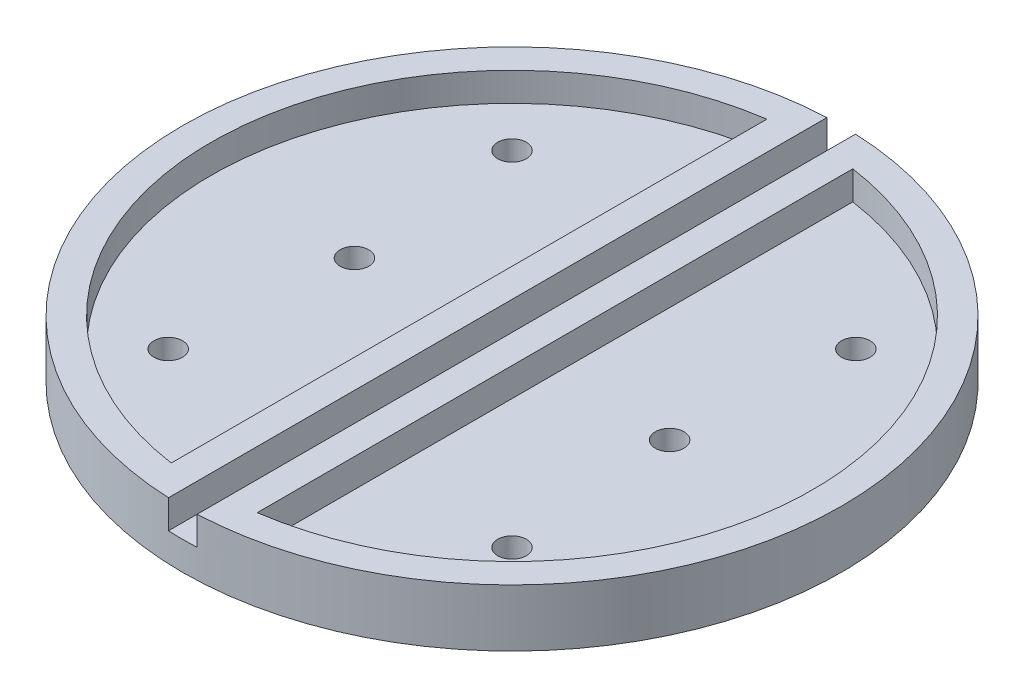
from build123d import *

# Parameters (mm, degrees)
SKETCH5_R           = 73.025
SKETCH5_R_2         = 3.175
PLATEBASE_DEPTH     = 6.35
PLATETOP_DEPTH      = 6.35
SKETCH9_R           = 73.025
SKETCH9_R_2         = 66.675
PLATEWALLS_DEPTH    = 6.35
TOPSLOTCUT_START    = -6.35
TOPSLOTCUT_DEPTH    = 6.35
BOTTOMSLOTCUT_START = -6.35
BOTTOMSLOTCUT_DEPTH = 6.35
SKETCH13_R          = 3.175
RIGHTTHRUHOLE_DEPTH = 6.35
SKETCH14_R          = 3.175
LEFTTHRUHOLE_DEPTH  = 6.35


with BuildPart() as part:
    # Sketch5 → PlateBase (new body)
    with BuildSketch(Plane(origin=(0, 0, 0), x_dir=(1, 0, 0), z_dir=(0, 1, 0))):
        Circle(SKETCH5_R)
        with Locations((38.1, 38.1)):
            Circle(SKETCH5_R_2, mode=Mode.SUBTRACT)
        with Locations((38.1, -38.1)):
            Circle(SKETCH5_R_2, mode=Mode.SUBTRACT)
        with Locations((-38.1, 38.1)):
            Circle(SKETCH5_R_2, mode=Mode.SUBTRACT)
        with Locations((-38.1, -38.1)):
            Circle(SKETCH5_R_2, mode=Mode.SUBTRACT)
    extrude(amount=PLATEBASE_DEPTH)

    # Sketch6 → PlateTop (add)
    with BuildSketch(Plane(origin=(0, 6.35, 0), x_dir=(1, 0, 0), z_dir=(0, 1, 0))):
        with BuildLine():
            Line((3.175, 72.955945611), (3.175, -72.955945611))
            ThreePointArc((3.175, -72.955945611), (6.35605636, -72.747860261), (9.525, -72.401139494))
            Line((9.525, -72.401139494), (9.525, 72.401139494))
            ThreePointArc((9.525, 72.401139494), (6.35605636, 72.747860261), (3.175, 72.955945611))
        make_face()
        with BuildLine():
            Line((-3.175, -72.955945611), (-3.175, 72.955945611))
            ThreePointArc((-3.175, 72.955945611), (-6.35605636, 72.747860261), (-9.525, 72.401139494))
            Line((-9.525, 72.401139494), (-9.525, -72.401139494))
            ThreePointArc((-9.525, -72.401139494), (-6.35605636, -72.747860261), (-3.175, -72.955945611))
        make_face()
    extrude(amount=PLATETOP_DEPTH)

    # Sketch9 → PlateWalls (add)
    with BuildSketch(Plane(origin=(0, 6.35, 0), x_dir=(1, 0, 0), z_dir=(0, 1, 0))):
        Circle(SKETCH9_R)
        Circle(SKETCH9_R_2, mode=Mode.SUBTRACT)
    extrude(amount=PLATEWALLS_DEPTH)

    # Sketch11 → TopSlotCut (cut)
    with BuildSketch(Plane(origin=(0, 12.7, 0), x_dir=(1, 0, 0), z_dir=(0, 1, 0)).offset(TOPSLOTCUT_START)):
        with BuildLine():
            Line((-3.175, 66.599361859), (-3.175, 72.955945611))
            ThreePointArc((-3.175, 72.955945611), (0, 73.025), (3.175, 72.955945611))
            Line((3.175, 72.955945611), (3.175, 66.599361859))
            Line((3.175, 66.599361859), (-3.175, 66.599361859))
        make_face()
    extrude(amount=TOPSLOTCUT_DEPTH, mode=Mode.SUBTRACT)

    # Sketch12 → BottomSlotCut (cut)
    with BuildSketch(Plane(origin=(0, 12.7, 0), x_dir=(1, 0, 0), z_dir=(0, 1, 0)).offset(BOTTOMSLOTCUT_START)):
        with BuildLine():
            Line((-3.175, -66.599361859), (-3.175, -72.955945611))
            ThreePointArc((-3.175, -72.955945611), (0, -73.025), (3.175, -72.955945611))
            Line((3.175, -72.955945611), (3.175, -66.599361859))
            Line((3.175, -66.599361859), (-3.175, -66.599361859))
        make_face()
    extrude(amount=BOTTOMSLOTCUT_DEPTH, mode=Mode.SUBTRACT)

    # Sketch13 → RightThruHole (cut)
    with BuildSketch(Plane(origin=(0, 6.35, 0), x_dir=(1, 0, 0), z_dir=(0, 1, 0))):
        with Locations((34.925, 0)):
            Circle(SKETCH13_R)
    extrude(amount=-RIGHTTHRUHOLE_DEPTH, mode=Mode.SUBTRACT)

    # Sketch14 → LeftThruHole (cut)
    with BuildSketch(Plane(origin=(0, 6.35, 0), x_dir=(1, 0, 0), z_dir=(0, 1, 0))):
        with Locations((-34.925, 0)):
            Circle(SKETCH14_R)
    extrude(amount=-LEFTTHRUHOLE_DEPTH, mode=Mode.SUBTRACT)


solid = part.part
